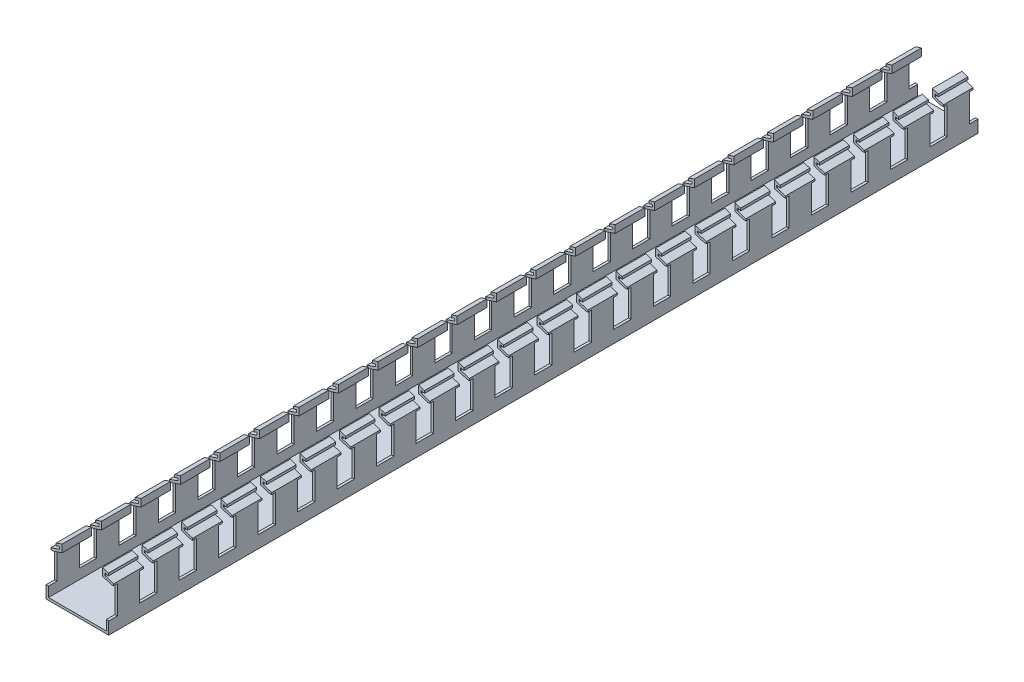
from build123d import *

# Parameters (mm, degrees)
SALIENTE_EXTRUIR1_DEPTH = 8
CORTAR_EXTRUIR1_DEPTH   = 33
MATRIZL1_COUNT          = 22
MATRIZL1_PITCH          = 16


with BuildPart() as part:
    # Croquis2 → Saliente-Extruir1 (new, symmetric)
    with BuildSketch(Plane.XY):
        with BuildLine():
            Line((-12.7, 0), (12.7, 0))
            Line((12.7, 0), (12.7, 17))
            Line((12.7, 17), (9.336754447, 18.121081851))
            ThreePointArc((9.336754447, 18.121081851), (9.237751563, 18.193876454), (9.2, 18.310818511))
            Line((9.2, 18.310818511), (9.2, 18.889181489))
            ThreePointArc((9.2, 18.889181489), (9.283057943, 19.051429926), (9.463245553, 19.078918149))
            Line((9.463245553, 19.078918149), (10.571708245, 18.709430585))
            Line((10.571708245, 18.709430585), (10.571708245, 19.709430585))
            Line((10.571708245, 19.709430585), (8.2, 20.5))
            Line((8.2, 20.5), (8.2, 17.445907447))
            Line((8.2, 17.445907447), (11.7, 16.27924078))
            Line((11.7, 16.27924078), (11.7, 1))
            Line((11.7, 1), (-11.7, 1))
            Line((-11.7, 1), (-11.7, 16.27924078))
            Line((-11.7, 16.27924078), (-8.2, 17.445907447))
            Line((-8.2, 17.445907447), (-8.2, 20.5))
            Line((-8.2, 20.5), (-10.571708245, 19.709430585))
            Line((-10.571708245, 19.709430585), (-10.571708245, 18.709430585))
            Line((-10.571708245, 18.709430585), (-9.463245553, 19.078918149))
            ThreePointArc((-9.463245553, 19.078918149), (-9.283057943, 19.051429926), (-9.2, 18.889181489))
            Line((-9.2, 18.889181489), (-9.2, 18.310818511))
            ThreePointArc((-9.2, 18.310818511), (-9.237751563, 18.193876454), (-9.336754447, 18.121081851))
            Line((-9.336754447, 18.121081851), (-12.7, 17))
            Line((-12.7, 17), (-12.7, 0))
        make_face()
    saliente_extruir1 = extrude(amount=SALIENTE_EXTRUIR1_DEPTH, both=True)

    # Croquis3 → Cortar-Extruir1 (cut, symmetric)
    with BuildSketch(Plane(origin=(0, 0, 0), x_dir=(0, 0, -1), z_dir=(1, 0, 0))):
        Polygon((-8, 5), (-4.5, 5), (-4.5, 16.27924078), (-6, 16.27924078), (-6, 20.5), (-8, 20.5), align=None)
        Polygon((8, 20.5), (6, 20.5), (6, 16.27924078), (4.5, 16.27924078), (4.5, 5), (8, 5), align=None)
    cortar_extruir1 = extrude(amount=CORTAR_EXTRUIR1_DEPTH, both=True, mode=Mode.SUBTRACT)

    # MatrizL1: Saliente-Extruir1, Cortar-Extruir1 ×22
    with Locations(*[(0, 0, -i * MATRIZL1_PITCH) for i in range(1, MATRIZL1_COUNT)]):
        add(saliente_extruir1)
        add(cortar_extruir1, mode=Mode.SUBTRACT)


solid = part.part
